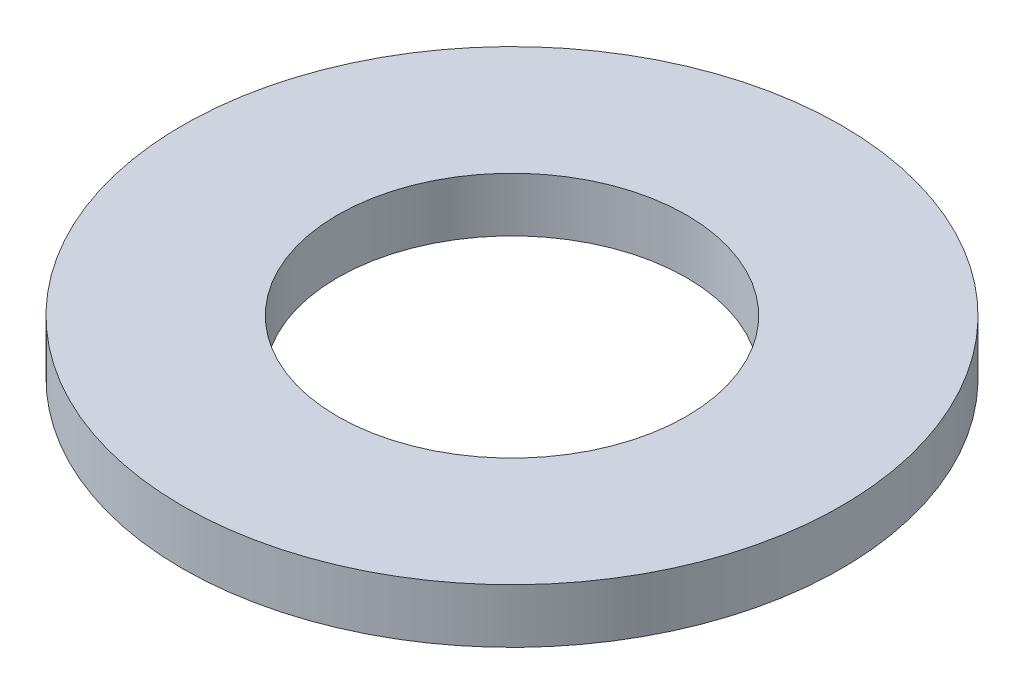
from build123d import *

# Parameters (mm, degrees)
SKETCH1_R           = 85
BOSS_EXTRUDE1_DEPTH = 14
SKETCH2_R           = 45
CUT_EXTRUDE1_DEPTH  = 122.020659393


with BuildPart() as part:
    # Sketch1 → Boss-Extrude1 (new body)
    with BuildSketch(Plane(origin=(0, 0, 0), x_dir=(1, 0, 0), z_dir=(0, 1, 0))):
        Circle(SKETCH1_R)
    extrude(amount=BOSS_EXTRUDE1_DEPTH)

    # Sketch2 → Cut-Extrude1 (cut, through all)
    with BuildSketch(Plane(origin=(0, 0, 0), x_dir=(1, 0, 0), z_dir=(0, 1, 0))):
        Circle(SKETCH2_R)
    extrude(amount=CUT_EXTRUDE1_DEPTH, mode=Mode.SUBTRACT)


solid = part.part
